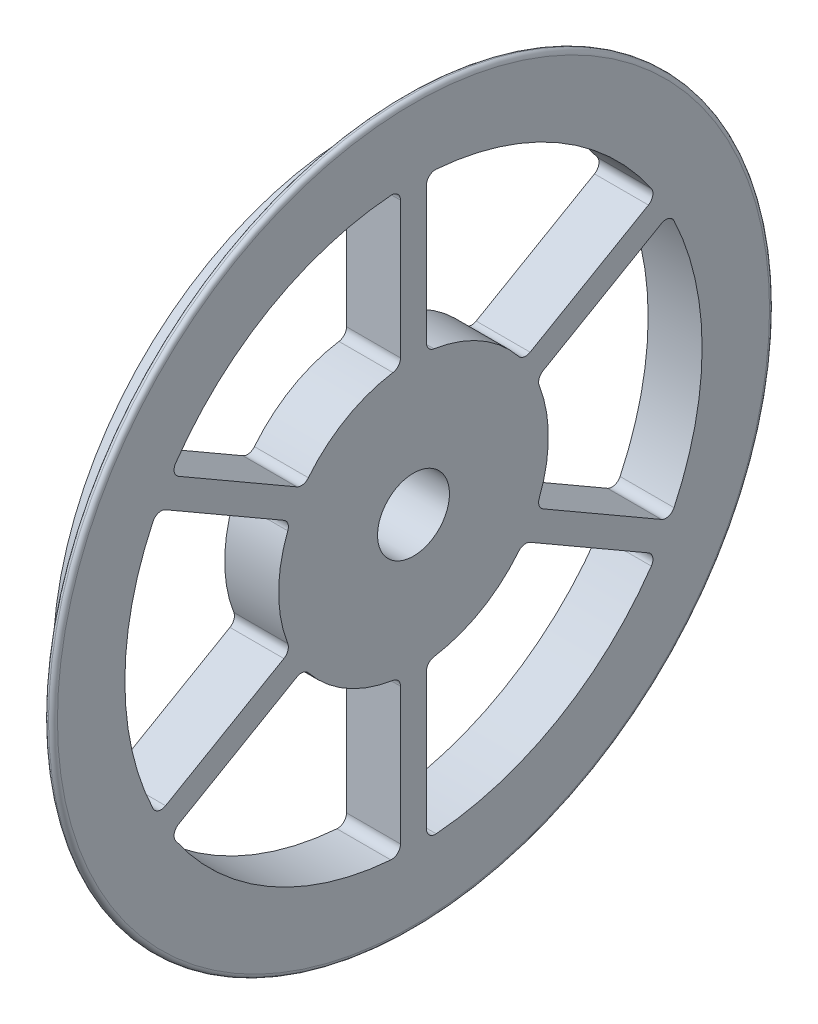
from build123d import *

# Parameters (mm, degrees)
CUT_EXTRUDE2_DEPTH      = 58.026485075
FILLET1_R               = 0.5
CUT_EXTRUDE5_DEPTH      = 58.026485145
CUT_EXTRUDE5_DEPTH_BACK = 58.026485145
SKETCH7_R               = 4
SKETCH9_R               = 50
SKETCH9_R_2             = 34.1
CUT_EXTRUDE6_DEPTH      = 4


with BuildPart() as part:
    # Sketch1 → Revolve2 (revolve)
    with BuildSketch(Plane.XY, mode=Mode.PRIVATE) as revolve2_sk:
        Polygon((-3, 0), (-3, 38.05), (2, 38.05), (2, 40.1), (3, 40.1), (3, 0), align=None)
    revolve(revolve2_sk.sketch.rotate(Axis((3, 0, 0), (-1, 0, 0)), 90), axis=Axis((3, 0, 0), (-1, 0, 0)))

    # Sketch2 → Cut-Extrude2 (cut, through all)
    with BuildSketch(Plane.ZY.offset(-3)):
        with BuildLine():
            Line((14.415571014, 6.656167139), (27.571826318, 14.25193468))
            ThreePointArc((27.571826318, 14.25193468), (28.368418684, 14.340913448), (28.97445739, 13.816324366))
            ThreePointArc((28.97445739, 13.816324366), (32.1, 0), (28.97445739, -13.816324366))
            ThreePointArc((28.97445739, -13.816324366), (28.368418684, -14.340913448), (27.571826318, -14.25193468))
            Line((27.571826318, -14.25193468), (14.415571014, -6.656167139))
            ThreePointArc((14.415571014, -6.656167139), (13.972302174, -6.122171697), (13.983347826, -5.428257877))
            ThreePointArc((13.983347826, -5.428257877), (15, 0), (13.983347826, 5.428257877))
            ThreePointArc((13.983347826, 5.428257877), (13.972302174, 6.122171697), (14.415571014, 6.656167139))
        make_face()
        with BuildLine():
            Line((12.972195341, -9.156167139), (26.128450645, -16.75193468))
            ThreePointArc((26.128450645, -16.75193468), (26.603804702, -17.397314521), (26.452516582, -18.184453977))
            ThreePointArc((26.452516582, -18.184453977), (16.05, -27.799415461), (2.521940807, -32.000778343))
            ThreePointArc((2.521940807, -32.000778343), (1.764613982, -31.73822797), (1.443375673, -31.00386936))
            Line((1.443375673, -31.00386936), (1.443375673, -15.812334278))
            ThreePointArc((1.443375673, -15.812334278), (1.684194871, -15.161454481), (2.290664693, -14.824063386))
            ThreePointArc((2.290664693, -14.824063386), (7.5, -12.990381057), (11.692683133, -9.395805509))
            ThreePointArc((11.692683133, -9.395805509), (12.288107303, -9.039282784), (12.972195341, -9.156167139))
        make_face()
        with BuildLine():
            Line((-1.443375673, -15.812334278), (-1.443375673, -31.00386936))
            ThreePointArc((-1.443375673, -31.00386936), (-1.764613982, -31.73822797), (-2.521940807, -32.000778343))
            ThreePointArc((-2.521940807, -32.000778343), (-16.05, -27.799415461), (-26.452516582, -18.184453977))
            ThreePointArc((-26.452516582, -18.184453977), (-26.603804702, -17.397314521), (-26.128450645, -16.75193468))
            Line((-26.128450645, -16.75193468), (-12.972195341, -9.156167139))
            ThreePointArc((-12.972195341, -9.156167139), (-12.288107303, -9.039282784), (-11.692683133, -9.395805509))
            ThreePointArc((-11.692683133, -9.395805509), (-7.5, -12.990381057), (-2.290664693, -14.824063386))
            ThreePointArc((-2.290664693, -14.824063386), (-1.684194871, -15.161454481), (-1.443375673, -15.812334278))
        make_face()
        with BuildLine():
            Line((-14.415571014, -6.656167139), (-27.571826318, -14.25193468))
            ThreePointArc((-27.571826318, -14.25193468), (-28.368418684, -14.340913448), (-28.97445739, -13.816324366))
            ThreePointArc((-28.97445739, -13.816324366), (-32.1, 0), (-28.97445739, 13.816324366))
            ThreePointArc((-28.97445739, 13.816324366), (-28.368418684, 14.340913448), (-27.571826318, 14.25193468))
            Line((-27.571826318, 14.25193468), (-14.415571014, 6.656167139))
            ThreePointArc((-14.415571014, 6.656167139), (-13.972302174, 6.122171697), (-13.983347826, 5.428257877))
            ThreePointArc((-13.983347826, 5.428257877), (-15, 0), (-13.983347826, -5.428257877))
            ThreePointArc((-13.983347826, -5.428257877), (-13.972302174, -6.122171697), (-14.415571014, -6.656167139))
        make_face()
        with BuildLine():
            Line((-12.972195341, 9.156167139), (-26.128450645, 16.75193468))
            ThreePointArc((-26.128450645, 16.75193468), (-26.603804702, 17.397314521), (-26.452516582, 18.184453977))
            ThreePointArc((-26.452516582, 18.184453977), (-16.05, 27.799415461), (-2.521940807, 32.000778343))
            ThreePointArc((-2.521940807, 32.000778343), (-1.764613982, 31.73822797), (-1.443375673, 31.00386936))
            Line((-1.443375673, 31.00386936), (-1.443375673, 15.812334278))
            ThreePointArc((-1.443375673, 15.812334278), (-1.684194871, 15.161454481), (-2.290664693, 14.824063386))
            ThreePointArc((-2.290664693, 14.824063386), (-7.5, 12.990381057), (-11.692683133, 9.395805509))
            ThreePointArc((-11.692683133, 9.395805509), (-12.288107303, 9.039282784), (-12.972195341, 9.156167139))
        make_face()
        with BuildLine():
            Line((1.443375673, 15.812334278), (1.443375673, 31.00386936))
            ThreePointArc((1.443375673, 31.00386936), (1.764613982, 31.73822797), (2.521940807, 32.000778343))
            ThreePointArc((2.521940807, 32.000778343), (16.05, 27.799415461), (26.452516582, 18.184453977))
            ThreePointArc((26.452516582, 18.184453977), (26.603804702, 17.397314521), (26.128450645, 16.75193468))
            Line((26.128450645, 16.75193468), (12.972195341, 9.156167139))
            ThreePointArc((12.972195341, 9.156167139), (12.288107303, 9.039282784), (11.692683133, 9.395805509))
            ThreePointArc((11.692683133, 9.395805509), (7.5, 12.990381057), (2.290664693, 14.824063386))
            ThreePointArc((2.290664693, 14.824063386), (1.684194871, 15.161454481), (1.443375673, 15.812334278))
        make_face()
    extrude(amount=CUT_EXTRUDE2_DEPTH, mode=Mode.SUBTRACT)

    # Fillet1
    fillet1_edges = [part.edges().sort_by_distance(p)[0] for p in [
        (3, 0, 40.1),
        (2, 0, 40.1),
    ]]
    fillet(fillet1_edges, radius=FILLET1_R - 0.0001)  # a hair under: the kernel refuses the full size

    # Sketch7 → Cut-Extrude5 (cut, two sides: drawn at the far end of the back side and taken through both)
    with BuildSketch(Plane(origin=(3, 0, 0), x_dir=(0, 0, -1), z_dir=(1, 0, 0)).offset(-CUT_EXTRUDE5_DEPTH_BACK)):
        Circle(SKETCH7_R)
    extrude(amount=CUT_EXTRUDE5_DEPTH + CUT_EXTRUDE5_DEPTH_BACK, mode=Mode.SUBTRACT)

    # Sketch9 → Cut-Extrude6 (cut)
    with BuildSketch(Plane.ZY.offset(3)):
        Circle(SKETCH9_R)
        Circle(SKETCH9_R_2, mode=Mode.SUBTRACT)
    extrude(amount=-CUT_EXTRUDE6_DEPTH, mode=Mode.SUBTRACT)


solid = part.part
